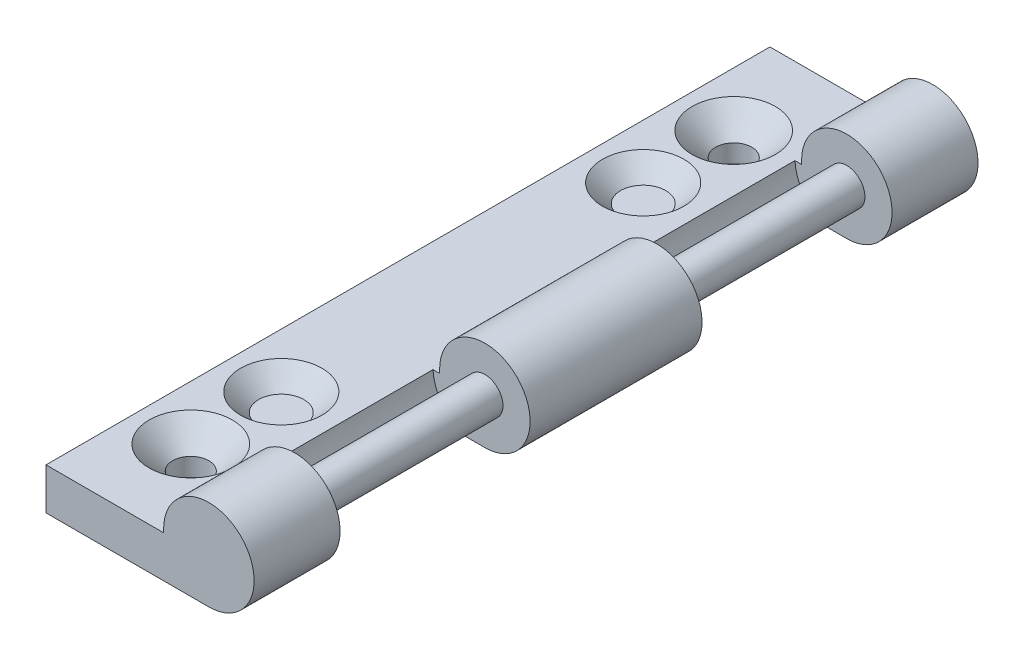
from build123d import *

# Parameters (mm, degrees)
SKETCH1_W           = 9
SKETCH1_H           = 40
BOSS_EXTRUDE1_DEPTH = 2.5
SKETCH2_R           = 2.5
BOSS_EXTRUDE2_DEPTH = 40
CUT_EXTRUDE1_START  = -4.75
SKETCH3_R           = 2.875
CUT_EXTRUDE1_DEPTH  = 10.5
BOSS_EXTRUDE3_REACH = 28.806
SKETCH4_R           = 1
SKETCH5_R           = 1
CUT_EXTRUDE2_DEPTH  = 42.076148797
CHAMFER1_SIZE       = 1.5
CHAMFER2_SIZE       = 1.5
SKETCH6_W           = 6.5
SKETCH6_H           = 0.2
CUT_EXTRUDE3_DEPTH  = 42.303752856
SKETCH7_R           = 1.25
CUT_EXTRUDE4_DEPTH  = 1
CHAMFER3_SIZE       = 1


with BuildPart() as part:
    # Sketch1 → Boss-Extrude1 (new body)
    with BuildSketch(Plane(origin=(0, 0, 0), x_dir=(1, 0, 0), z_dir=(0, 1, 0))):
        with Locations((-4.5, 20)):
            Rectangle(SKETCH1_W, SKETCH1_H)
    extrude(amount=BOSS_EXTRUDE1_DEPTH)

    # Sketch2 → Boss-Extrude2 (add)
    with BuildSketch(Plane.XY):
        with Locations((0, 2.5)):
            Circle(SKETCH2_R)
    extrude(amount=-BOSS_EXTRUDE2_DEPTH)

    # Sketch3 → Cut-Extrude1 (cut)
    with BuildSketch(Plane.XY.offset(CUT_EXTRUDE1_START)):
        with Locations((0, 2.5)):
            Circle(SKETCH3_R)
    cut_extrude1 = extrude(amount=-CUT_EXTRUDE1_DEPTH, mode=Mode.SUBTRACT)

    # Mirror1: Cut-Extrude1 across plane
    add(cut_extrude1.mirror(Plane.XY.offset(-20)), mode=Mode.SUBTRACT)

    # Sketch4 → Boss-Extrude3 (add, up to next)
    with BuildSketch(Plane.XY.offset(-15.25), mode=Mode.PRIVATE) as boss_extrude3_sk1:
        with Locations((0, 2.5)):
            Circle(SKETCH4_R)
    boss_extrude3_tool1 = extrude(boss_extrude3_sk1.sketch, amount=BOSS_EXTRUDE3_REACH, mode=Mode.PRIVATE) - part.part
    boss_extrude3 = boss_extrude3_tool1.solids().sort_by_distance((0, 2.5, -15.25))[0]
    add(boss_extrude3)

    # Mirror2: Boss-Extrude3 across plane
    add(boss_extrude3.mirror(Plane.XY.offset(-20)))

    # Sketch5 → Cut-Extrude2 (cut, through all)
    with BuildSketch(Plane(origin=(0, 2.5, 0), x_dir=(1, 0, 0), z_dir=(0, 1, 0))):
        with Locations(Location((-6, 5, 0), (0, 0, 270))):
            Circle(SKETCH5_R)
    cut_extrude2 = extrude(amount=-CUT_EXTRUDE2_DEPTH, mode=Mode.SUBTRACT)

    # Mirror3: Cut-Extrude2 across plane
    add(cut_extrude2.mirror(Plane.XY.offset(-20)), mode=Mode.SUBTRACT)

    # Chamfer1
    chamfer1_edges = [part.edges().sort_by_distance(p)[0] for p in [
        (-6, 2.5, -6),
    ]]
    chamfer(chamfer1_edges, length=CHAMFER1_SIZE)

    # Chamfer2
    chamfer2_edges = [part.edges().sort_by_distance(p)[0] for p in [
        (-6, 2.5, -34),
    ]]
    chamfer(chamfer2_edges, length=CHAMFER2_SIZE)

    # Sketch6 → Cut-Extrude3 (cut, through all)
    with BuildSketch(Plane.XY):
        with Locations((-5.75, 2.4)):
            Rectangle(SKETCH6_W, SKETCH6_H)
    extrude(amount=-CUT_EXTRUDE3_DEPTH, mode=Mode.SUBTRACT)

    # Sketch7 → Cut-Extrude4 (cut)
    with BuildSketch(Plane(origin=(0, 2.3, 0), x_dir=(1, 0, 0), z_dir=(0, 1, 0))):
        with Locations(Location((-6, 30, 0), (0, 0, 270))):
            Circle(SKETCH7_R)
        with Locations(Location((-6, 10, 0), (0, 0, 270))):
            Circle(SKETCH7_R)
    extrude(amount=-CUT_EXTRUDE4_DEPTH, mode=Mode.SUBTRACT)

    # Chamfer3
    chamfer3_edges = [part.edges().sort_by_distance(p)[0] for p in [
        (-6, 2.3, -31.25),
        (-6, 2.3, -11.25),
    ]]
    chamfer(chamfer3_edges, length=CHAMFER3_SIZE - 0.0001)  # a hair under: the kernel refuses the full size


solid = part.part
